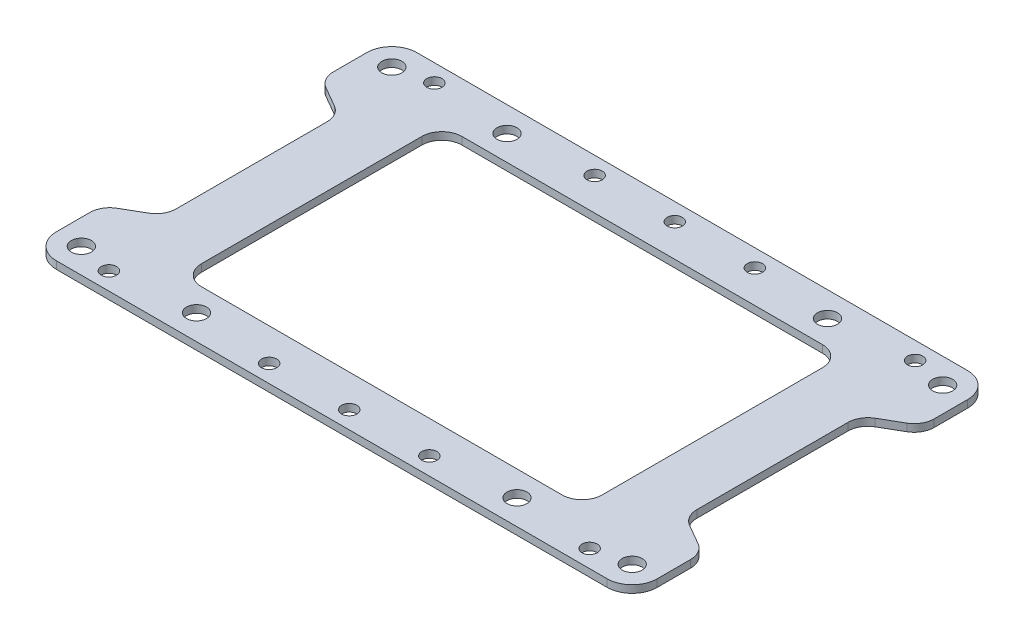
from build123d import *

# Parameters (mm, degrees)
SKETCH1_W          = 190.5
SKETCH1_H          = 114.3
SKETCH1_R          = 2.413
SKETCH1_W_2        = 127
SKETCH1_H_2        = 82.55
BASE_FLANGE1_DEPTH = 2.38125
FILLET1_R          = 7.9375
FILLET3_R          = 6.35
SKETCH3_R          = 3.175
CUT_EXTRUDE2_DEPTH = 2.38125
CUT_EXTRUDE3_DEPTH = 2.38125
FILLET4_R          = 6.35
SKETCH5_R          = 3.175
CUT_EXTRUDE4_DEPTH = 2.38125


# Sheet-metal steps are written as plain solids
with BuildPart() as part:
    # Sketch1 → Base-Flange1 (new body)
    with BuildSketch(Plane(origin=(0, 0, 0), x_dir=(1, 0, 0), z_dir=(0, 1, 0))):
        Rectangle(SKETCH1_W, SKETCH1_H)
        with Locations(Location((-76.2, -51.59375, 0), (0, 0, 270))):
            Circle(SKETCH1_R, mode=Mode.SUBTRACT)
        with Locations(Location((-25.4, -51.59375, 0), (0, 0, 270))):
            Circle(SKETCH1_R, mode=Mode.SUBTRACT)
        with Locations(Location((0, -51.59375, 0), (0, 0, 270))):
            Circle(SKETCH1_R, mode=Mode.SUBTRACT)
        with Locations(Location((25.4, -51.59375, 0), (0, 0, 270))):
            Circle(SKETCH1_R, mode=Mode.SUBTRACT)
        with Locations(Location((76.2, -51.59375, 0), (0, 0, 270))):
            Circle(SKETCH1_R, mode=Mode.SUBTRACT)
        with Locations(Location((76.2, 51.59375, 0), (0, 0, 270))):
            Circle(SKETCH1_R, mode=Mode.SUBTRACT)
        with Locations(Location((25.4, 51.59375, 0), (0, 0, 270))):
            Circle(SKETCH1_R, mode=Mode.SUBTRACT)
        with Locations(Location((0, 51.59375, 0), (0, 0, 270))):
            Circle(SKETCH1_R, mode=Mode.SUBTRACT)
        with Locations(Location((-25.4, 51.59375, 0), (0, 0, 270))):
            Circle(SKETCH1_R, mode=Mode.SUBTRACT)
        with Locations(Location((-76.2, 51.59375, 0), (0, 0, 270))):
            Circle(SKETCH1_R, mode=Mode.SUBTRACT)
        Rectangle(SKETCH1_W_2, SKETCH1_H_2, mode=Mode.SUBTRACT)
    extrude(amount=-BASE_FLANGE1_DEPTH)

    # Fillet1
    fillet1_edges = [part.edges().sort_by_distance(p)[0] for p in [
        (-95.25, -1.190625, -57.15),
        (95.25, -1.190625, -57.15),
        (95.25, -1.190625, 57.15),
        (-95.25, -1.190625, 57.15),
    ]]
    fillet(fillet1_edges, radius=FILLET1_R)

    # Fillet3
    fillet3_edges = [part.edges().sort_by_distance(p)[0] for p in [
        (-63.5, -1.190625, 41.275),
        (-63.5, -1.190625, -41.275),
        (63.5, -1.190625, -41.275),
        (63.5, -1.190625, 41.275),
    ]]
    fillet(fillet3_edges, radius=FILLET3_R)

    # Sketch3 → Cut-Extrude2 (cut)
    with BuildSketch(Plane(origin=(0, 0, 0), x_dir=(1, 0, 0), z_dir=(0, 1, 0))):
        with Locations(Location((-87.3125, 49.2125, 0), (0, 0, 270))):
            Circle(SKETCH3_R)
        with Locations(Location((87.3125, 49.2125, 0), (0, 0, 270))):
            Circle(SKETCH3_R)
        with Locations(Location((87.3125, -49.2125, 0), (0, 0, 270))):
            Circle(SKETCH3_R)
        with Locations(Location((-87.3125, -49.2125, 0), (0, 0, 270))):
            Circle(SKETCH3_R)
    extrude(amount=-CUT_EXTRUDE2_DEPTH, mode=Mode.SUBTRACT)

    # Sketch4 → Cut-Extrude3 (cut)
    with BuildSketch(Plane(origin=(0, 0, 0), x_dir=(1, 0, 0), z_dir=(0, 1, 0))):
        Polygon((-95.25, 34.925), (-82.55, 27.592651581), (-82.55, -27.592651581), (-95.25, -34.925), align=None)
        Polygon((95.25, 34.925), (95.25, -34.925), (82.55, -27.592651581), (82.55, 27.592651581), align=None)
    extrude(amount=-CUT_EXTRUDE3_DEPTH, mode=Mode.SUBTRACT)

    # Fillet4
    fillet4_edges = [part.edges().sort_by_distance(p)[0] for p in [
        (-95.25, -1.190625, 34.925),
        (-95.25, -1.190625, -34.925),
        (-82.55, -1.190625, -27.592651581),
        (-82.55, -1.190625, 27.592651581),
        (82.55, -1.190625, -27.592651581),
        (95.25, -1.190625, -34.925),
        (95.25, -1.190625, 34.925),
        (82.55, -1.190625, 27.592651581),
    ]]
    fillet(fillet4_edges, radius=FILLET4_R)

    # Sketch5 → Cut-Extrude4 (cut)
    with BuildSketch(Plane(origin=(0, 0, 0), x_dir=(1, 0, 0), z_dir=(0, 1, 0))):
        with Locations(Location((-50.8, -49.2125, 0), (0, 0, 270))):
            Circle(SKETCH5_R)
        with Locations(Location((50.8, -49.2125, 0), (0, 0, 270))):
            Circle(SKETCH5_R)
        with Locations(Location((50.8, 49.2125, 0), (0, 0, 270))):
            Circle(SKETCH5_R)
        with Locations(Location((-50.8, 49.2125, 0), (0, 0, 270))):
            Circle(SKETCH5_R)
    extrude(amount=-CUT_EXTRUDE4_DEPTH, mode=Mode.SUBTRACT)


solid = part.part
